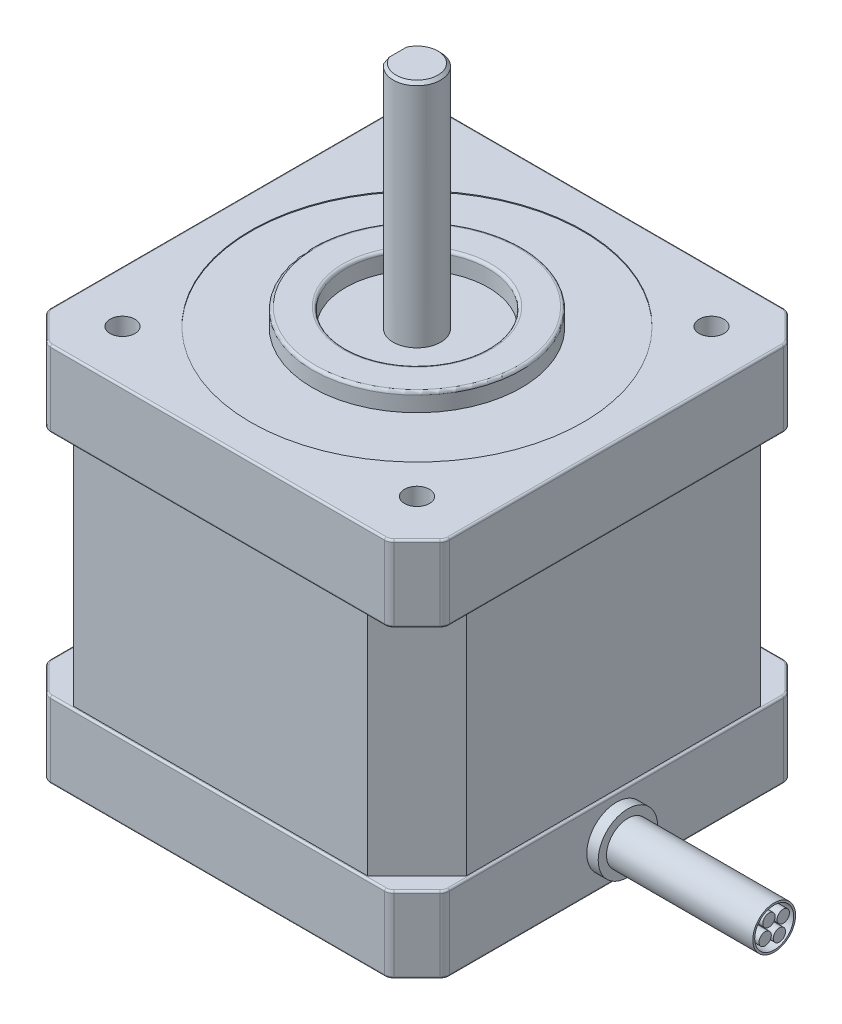
from build123d import *

# Parameters (mm, degrees)
SKETCH_1_W               = 42
SKETCH_1_H               = 42
EXTRUDE_1_DEPTH          = 40
CHAMFER_3_SIZE           = 3
SKETCH_2_R               = 11
EXTRUDE_2_DEPTH          = 1.8
SKETCH_3_R               = 2.5
EXTRUDE_3_DEPTH          = 24
SKETCH_4_OUTSIDE_W       = 61.464
SKETCH_4_OUTSIDE_H       = 61.464
CUT_EXTRUDE_1_DEPTH      = 24
FILLET_2_R               = 1
FILLET_3_R               = 0.2
CUT_EXTRUDE_START        = -15
CUT_EXTRUDE_5_DEPTH      = 15
CHAMFER_5_SIZE           = 0.3
CHAMFER_4_SIZE           = 0.5
SKETCH_6_R               = 1.3105
CUT_EXTRUDE_2_DEPTH      = 4.5
CUT_EXTRUDE_START_2      = -2
SKETCH_7_R               = 7.5
SKETCH_7_R_2             = 2.5
CUT_EXTRUDE_3_DEPTH      = 2
SKETCH_8_R               = 3.125
EXTRUDE_5_DEPTH          = 1.2
SKETCH_9_R               = 2.25
SKETCH_9_R_2             = 2.05
EXTRUDE_6_DEPTH          = 15.4
SKETCH_10_R              = 0.65
EXTRUDE_8_DEPTH          = 15.4
CUT_EXTRUDE_START_3      = -0.1
SKETCH_15_R              = 17.5
SKETCH_15_R_2            = 11
CUT_EXTRUDE_6_DEPTH      = 0.1
FILLET_4_R               = 0.3
PATTERN_CIRCULAR_3_COUNT = 4


with BuildPart() as part:
    # 草图1 → 凸台-拉伸1 (new body)
    with BuildSketch(Plane(origin=(0, 0, 0), x_dir=(1, 0, 0), z_dir=(0, 1, 0))):
        Rectangle(SKETCH_1_W, SKETCH_1_H)
    extrude(amount=EXTRUDE_1_DEPTH)

    # 倒角3
    chamfer_3_edges = [part.edges().sort_by_distance(p)[0] for p in [
        (-21, 20, -21),
        (21, 20, -21),
        (21, 20, 21),
        (-21, 20, 21),
    ]]
    chamfer(chamfer_3_edges, length=CHAMFER_3_SIZE)

    # 草图2 → 凸台-拉伸2 (add)
    with BuildSketch(Plane(origin=(0, 40, 0), x_dir=(1, 0, 0), z_dir=(0, 1, 0))):
        with Locations(Location((0, 0, 0), (0, 0, 270))):
            Circle(SKETCH_2_R)
    extrude(amount=EXTRUDE_2_DEPTH)

    # 草图3 → 凸台-拉伸3 (add)
    with BuildSketch(Plane(origin=(0, 40, 0), x_dir=(1, 0, 0), z_dir=(0, 1, 0))):
        with Locations(Location((0, 0, 0), (0, 0, 270))):
            Circle(SKETCH_3_R)
    extrude(amount=EXTRUDE_3_DEPTH)

    # 草图4 outside → 切除-拉伸1 (cut)
    with BuildSketch(Plane.XZ.offset(-8)):
        Rectangle(SKETCH_4_OUTSIDE_W, SKETCH_4_OUTSIDE_H)
        Polygon((15.471572875, 20.7), (-15.471572875, 20.7), (-20.7, 15.471572875), (-20.7, -15.471572875), (-15.471572875, -20.7), (15.471572875, -20.7), (20.7, -15.471572875), (20.7, 15.471572875), align=None, mode=Mode.SUBTRACT)
    extrude(amount=-CUT_EXTRUDE_1_DEPTH, mode=Mode.SUBTRACT)

    # 圆角2
    fillet_2_edges = [part.edges().sort_by_distance(p)[0] for p in [
        (-18, 4, -21),
        (18, 36, -21),
        (21, 36, 18),
        (21, 4, -18),
        (-18, 36, 21),
        (18, 4, 21),
        (-21, 36, -18),
        (-21, 4, 18),
        (-18, 36, -21),
        (-21, 4, -18),
        (-21, 36, 18),
        (-18, 4, 21),
        (18, 36, 21),
        (21, 4, 18),
        (21, 36, -18),
        (18, 4, -21),
    ]]
    fillet(fillet_2_edges, radius=FILLET_2_R)

    # 圆角3
    fillet_3_edges = [part.edges().sort_by_distance(p)[0] for p in [
        (21, 8, 0),
        (21, 0, 0),
        (0, 0, -21),
        (19.5, 0, -19.5),
        (19.5, 0, 19.5),
        (0, 0, 21),
        (-19.5, 0, 19.5),
        (-21, 0, 0),
        (-19.5, 0, -19.5),
        (-20.923879533, 0, -17.96846987),
        (-17.96846987, 0, -20.923879533),
        (17.96846987, 0, -20.923879533),
        (20.923879533, 0, -17.96846987),
        (-20.923879533, 0, 17.96846987),
        (-17.96846987, 0, 20.923879533),
        (17.96846987, 0, 20.923879533),
        (20.923879533, 0, 17.96846987),
        (19.5, 8, 19.5),
        (19.5, 8, -19.5),
        (0, 8, -21),
        (-19.5, 8, -19.5),
        (-21, 8, 0),
        (-19.5, 8, 19.5),
        (0, 8, 21),
        (-20.923879533, 8, -17.96846987),
        (-17.96846987, 8, -20.923879533),
        (17.96846987, 8, -20.923879533),
        (20.923879533, 8, -17.96846987),
        (-20.923879533, 8, 17.96846987),
        (-17.96846987, 8, 20.923879533),
        (17.96846987, 8, 20.923879533),
        (20.923879533, 8, 17.96846987),
        (0, 32, -21),
        (0, 40, -21),
        (21, 40, 0),
        (19.5, 40, -19.5),
        (-19.5, 40, -19.5),
        (-21, 40, 0),
        (-19.5, 40, 19.5),
        (0, 40, 21),
        (19.5, 40, 19.5),
        (-20.923879533, 40, 17.96846987),
        (-17.96846987, 40, 20.923879533),
        (17.96846987, 40, 20.923879533),
        (20.923879533, 40, 17.96846987),
        (17.96846987, 40, -20.923879533),
        (20.923879533, 40, -17.96846987),
        (-20.923879533, 40, -17.96846987),
        (-17.96846987, 40, -20.923879533),
        (-19.5, 32, -19.5),
        (0, 32, 21),
        (-19.5, 32, 19.5),
        (-21, 32, 0),
        (19.5, 32, -19.5),
        (21, 32, 0),
        (19.5, 32, 19.5),
        (-20.923879533, 32, 17.96846987),
        (-17.96846987, 32, 20.923879533),
        (17.96846987, 32, 20.923879533),
        (20.923879533, 32, 17.96846987),
        (17.96846987, 32, -20.923879533),
        (20.923879533, 32, -17.96846987),
        (-20.923879533, 32, -17.96846987),
        (-17.96846987, 32, -20.923879533),
    ]]
    fillet(fillet_3_edges, radius=FILLET_3_R)

    # 草图14 → 切除-拉伸5 (cut)
    with BuildSketch(Plane(origin=(0, 64, 0), x_dir=(1, 0, 0), z_dir=(0, 1, 0)).offset(CUT_EXTRUDE_START)):
        with BuildLine():
            Line((-2, 1.5), (-2, -1.5))
            ThreePointArc((-2, -1.5), (-2.5, 0), (-2, 1.5))
        make_face()
    extrude(amount=CUT_EXTRUDE_5_DEPTH, mode=Mode.SUBTRACT)

    # 倒角5
    chamfer_5_edges = [part.edges().sort_by_distance(p)[0] for p in [
        (2.236067977, 64, -1.118033989),
    ]]
    chamfer(chamfer_5_edges, length=CHAMFER_5_SIZE)

    # 倒角4
    chamfer_4_edges = [part.edges().sort_by_distance(p)[0] for p in [
        (-2, 49, 0),
    ]]
    chamfer(chamfer_4_edges, length=CHAMFER_4_SIZE - 0.0001)  # a hair under: the kernel refuses the full size

    # 草图6 → 切除-拉伸2 (cut)
    with BuildSketch(Plane(origin=(0, 40, 0), x_dir=(1, 0, 0), z_dir=(0, 1, 0))):
        with Locations(Location((-15.5, 15.5, 0), (0, 0, 270))):
            Circle(SKETCH_6_R)
        with Locations(Location((15.5, 15.5, 0), (0, 0, 90))):
            Circle(SKETCH_6_R)
        with Locations(Location((15.5, -15.5, 0), (0, 0, 270))):
            Circle(SKETCH_6_R)
        with Locations(Location((-15.5, -15.5, 0), (0, 0, 90))):
            Circle(SKETCH_6_R)
    extrude(amount=-CUT_EXTRUDE_2_DEPTH, mode=Mode.SUBTRACT)

    # 草图7 → 切除-拉伸3 (cut)
    with BuildSketch(Plane(origin=(0, 41.8, 0), x_dir=(1, 0, 0), z_dir=(0, 1, 0)).offset(CUT_EXTRUDE_START_2)):
        with Locations(Location((0, 0, 0), (0, 0, 270))):
            Circle(SKETCH_7_R)
        with Locations(Location((0, 0, 0), (0, 0, 143.130102354))):
            Circle(SKETCH_7_R_2, mode=Mode.SUBTRACT)
    extrude(amount=CUT_EXTRUDE_3_DEPTH, mode=Mode.SUBTRACT)

    # 草图8 → 凸台-拉伸5 (add)
    with BuildSketch(Plane(origin=(21, 0, 0), x_dir=(0, 0, -1), z_dir=(1, 0, 0))):
        with Locations(Location((0, 4, 0), (0, 0, 180))):
            Circle(SKETCH_8_R)
    extrude(amount=EXTRUDE_5_DEPTH)

    # 草图9 → 凸台-拉伸6 (add)
    with BuildSketch(Plane(origin=(22.2, 0, 0), x_dir=(0, 0, -1), z_dir=(1, 0, 0))):
        with Locations(Location((0, 4, 0), (0, 0, 180))):
            Circle(SKETCH_9_R)
        with Locations(Location((0, 4, 0), (0, 0, 180))):
            Circle(SKETCH_9_R_2, mode=Mode.SUBTRACT)
    extrude(amount=EXTRUDE_6_DEPTH)

    # 草图10 → 凸台-拉伸8 (add)
    with BuildSketch(Plane(origin=(22.2, 0, 0), x_dir=(0, 0, -1), z_dir=(1, 0, 0))):
        with Locations((0.952627944, 4.55)):
            Circle(SKETCH_10_R)
    extrude_8 = extrude(amount=EXTRUDE_8_DEPTH)

    # 草图15 → 切除-拉伸6 (cut)
    with BuildSketch(Plane(origin=(0, 40, 0), x_dir=(1, 0, 0), z_dir=(0, 1, 0)).offset(CUT_EXTRUDE_START_3)):
        with Locations(Location((0, 0, 0), (0, 0, 270))):
            Circle(SKETCH_15_R)
        with Locations(Location((0, 0, 0), (0, 0, 270))):
            Circle(SKETCH_15_R_2, mode=Mode.SUBTRACT)
    extrude(amount=CUT_EXTRUDE_6_DEPTH, mode=Mode.SUBTRACT)

    # 圆角4
    fillet_4_edges = [part.edges().sort_by_distance(p)[0] for p in [
        (0, 41.8, -11),
        (0, 41.8, -7.5),
    ]]
    fillet(fillet_4_edges, radius=FILLET_4_R)

    # 阵列(圆周)3: 凸台-拉伸8 ×4 about axis
    pattern_circular_3_axis = Axis((0, 4, 0), (1, 0, 0))
    for i in range(1, PATTERN_CIRCULAR_3_COUNT):
        add(extrude_8.rotate(pattern_circular_3_axis, i * 360 / PATTERN_CIRCULAR_3_COUNT))


solid = part.part
